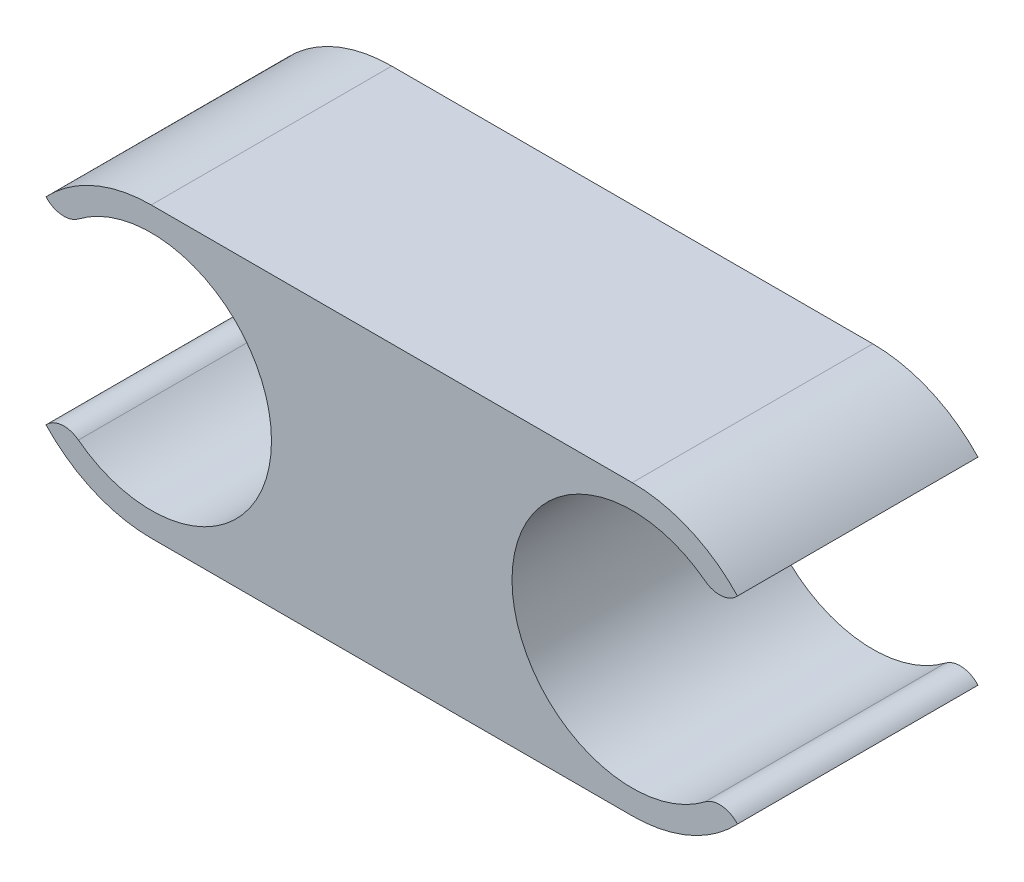
from build123d import *

# Parameters (mm, degrees)
EXTRUDE_1_DEPTH = 8
FILLET_1_R      = 0.8


with BuildPart() as part:
    # 草图1 → 凸台-拉伸1 (new body)
    with BuildSketch(Plane.XY):
        with BuildLine():
            Line((-25.471055476, -12.589310126), (-41.471055476, -12.589310126))
            ThreePointArc((-41.471055476, -12.589310126), (-38.076942926, -13.995197576), (-36.671055476, -17.389310126))
            ThreePointArc((-36.671055476, -17.389310126), (-38.076942926, -20.783422675), (-41.471055476, -22.189310126))
            Line((-41.471055476, -22.189310126), (-25.471055476, -22.189310126))
            ThreePointArc((-25.471055476, -22.189310126), (-30.271055476, -17.389310126), (-25.471055476, -12.589310126))
        make_face()
        with BuildLine():
            ThreePointArc((-36.671055476, -17.389310126), (-38.076942926, -13.995197576), (-41.471055476, -12.589310126))
            Line((-41.471055476, -12.589310126), (-41.471055476, -13.389310126))
            ThreePointArc((-41.471055476, -13.389310126), (-38.642628351, -14.560883001), (-37.471055476, -17.389310126))
            ThreePointArc((-37.471055476, -17.389310126), (-38.642628351, -20.21773725), (-41.471055476, -21.389310126))
            Line((-41.471055476, -21.389310126), (-41.471055476, -22.189310126))
            ThreePointArc((-41.471055476, -22.189310126), (-38.076942926, -20.783422675), (-36.671055476, -17.389310126))
        make_face()
        with BuildLine():
            Line((-25.471055476, -13.389310126), (-25.471055476, -12.589310126))
            ThreePointArc((-25.471055476, -12.589310126), (-30.271055476, -17.389310126), (-25.471055476, -22.189310126))
            Line((-25.471055476, -22.189310126), (-25.471055476, -21.389310126))
            ThreePointArc((-25.471055476, -21.389310126), (-29.471055476, -17.389310126), (-25.471055476, -13.389310126))
        make_face()
        with BuildLine():
            ThreePointArc((-21.971055476, -14.104496584), (-23.564108308, -12.984363758), (-25.471055476, -12.589310126))
            Line((-25.471055476, -12.589310126), (-25.471055476, -13.389310126))
            ThreePointArc((-25.471055476, -13.389310126), (-23.43954947, -13.943590557), (-21.971055476, -15.452818452))
            Line((-21.971055476, -15.452818452), (-21.971055476, -14.104496584))
        make_face()
        with BuildLine():
            Line((-25.471055476, -21.389310126), (-25.471055476, -22.189310126))
            ThreePointArc((-25.471055476, -22.189310126), (-23.564108308, -21.794256493), (-21.971055476, -20.674123667))
            Line((-21.971055476, -20.674123667), (-21.971055476, -19.325801799))
            ThreePointArc((-21.971055476, -19.325801799), (-23.43954947, -20.835029694), (-25.471055476, -21.389310126))
        make_face()
        with BuildLine():
            ThreePointArc((-21.971055476, -14.104496584), (-23.564108308, -12.984363758), (-25.471055476, -12.589310126))
            Line((-25.471055476, -12.589310126), (-25.471055476, -13.389310126))
            ThreePointArc((-25.471055476, -13.389310126), (-23.43954947, -13.943590557), (-21.971055476, -15.452818452))
            Line((-21.971055476, -15.452818452), (-21.971055476, -14.104496584))
        make_face()
        with BuildLine():
            Line((-25.471055476, -21.389310126), (-25.471055476, -22.189310126))
            ThreePointArc((-25.471055476, -22.189310126), (-23.564108308, -21.794256493), (-21.971055476, -20.674123667))
            Line((-21.971055476, -20.674123667), (-21.971055476, -19.325801799))
            ThreePointArc((-21.971055476, -19.325801799), (-23.43954947, -20.835029694), (-25.471055476, -21.389310126))
        make_face()
        with BuildLine():
            Line((-41.471055476, -13.389310126), (-41.471055476, -12.589310126))
            ThreePointArc((-41.471055476, -12.589310126), (-43.378002644, -12.984363758), (-44.971055476, -14.104496584))
            Line((-44.971055476, -14.104496584), (-44.971055476, -15.452818452))
            ThreePointArc((-44.971055476, -15.452818452), (-43.502561482, -13.943590557), (-41.471055476, -13.389310126))
        make_face()
        with BuildLine():
            Line((-41.471055476, -22.189310126), (-41.471055476, -21.389310126))
            ThreePointArc((-41.471055476, -21.389310126), (-43.502561482, -20.835029694), (-44.971055476, -19.325801799))
            Line((-44.971055476, -19.325801799), (-44.971055476, -20.674123667))
            ThreePointArc((-44.971055476, -20.674123667), (-43.378002644, -21.794256493), (-41.471055476, -22.189310126))
        make_face()
        with BuildLine():
            Line((-41.471055476, -13.389310126), (-41.471055476, -12.589310126))
            ThreePointArc((-41.471055476, -12.589310126), (-43.378002644, -12.984363758), (-44.971055476, -14.104496584))
            Line((-44.971055476, -14.104496584), (-44.971055476, -15.452818452))
            ThreePointArc((-44.971055476, -15.452818452), (-43.502561482, -13.943590557), (-41.471055476, -13.389310126))
        make_face()
        with BuildLine():
            Line((-41.471055476, -22.189310126), (-41.471055476, -21.389310126))
            ThreePointArc((-41.471055476, -21.389310126), (-43.502561482, -20.835029694), (-44.971055476, -19.325801799))
            Line((-44.971055476, -19.325801799), (-44.971055476, -20.674123667))
            ThreePointArc((-44.971055476, -20.674123667), (-43.378002644, -21.794256493), (-41.471055476, -22.189310126))
        make_face()
    extrude(amount=EXTRUDE_1_DEPTH)

    # 圆角1
    # the kernel refuses this fillet: 0.8 mm, written as the material it takes off along each edge
    with BuildSketch(Plane(origin=(-21.971055476, -15.452818452, -4.122167705), x_dir=(0, 1, 0), z_dir=(0, 0, 1)), Plane(origin=(-44.971055476, -19.325801799, -4.122167705), x_dir=(0, -1, 0), z_dir=(0, 0, 1))) as fillet_1_piece_1:
        with BuildLine():
            CenterArc((1.884003799, 0.594175789), FILLET_1_R, 142.743805491, 85.219808153)
            Line((1.247254554, 1.078479824), (1.234519569, 1.088165905))
            ThreePointArc((1.234519569, 1.088165905), (0.66933609, 0.486377982), (-0.007745967, 0.014))
            Line((-0.007745967, 0.014), (0, -0.016))
            ThreePointArc((0, -0.016), (0.674160934, -0.016), (1.337608229, -0.011883516))
            Line((1.337608229, -0.011883516), (1.348321868, 0))
        make_face()
    extrude(amount=16.24433541, mode=Mode.SUBTRACT)
    with BuildSketch(Plane(origin=(-21.971055476, -19.325801799, -4.122167705), x_dir=(-0.6540732337391989, -0.7564312294623664, 0), z_dir=(0, 0, 1))) as fillet_1_piece_2:
        with BuildLine():
            CenterArc((1.81375379, 0.782823335), FILLET_1_R, 172.885801288, 85.219808153)
            Line((1.019912768, 0.881901244), (1.004035948, 0.883882803))
            ThreePointArc((1.004035948, 0.883882803), (0.499491212, 0.453053522), (-0.010465172, 0.0121029))
            Line((-0.010465172, 0.0121029), (0.003297734, -0.015656467))
            ThreePointArc((0.003297734, -0.015656467), (0.824433541, 0.069883326), (1.645569348, -0.015656467))
            Line((1.645569348, -0.015656467), (1.648867082, 0))
        make_face()
    extrude(amount=16.24433541, mode=Mode.SUBTRACT)
    with BuildSketch(Plane(origin=(-44.971055476, -15.452818452, -4.122167705), x_dir=(0, 1, 0), z_dir=(0, 0, 1))) as fillet_1_piece_3:
        with BuildLine():
            CenterArc((1.884003799, -0.594175789), FILLET_1_R, 132.036386357, 85.219808153)
            Line((1.247254554, -1.078479824), (1.234519569, -1.088165905))
            ThreePointArc((1.234519569, -1.088165905), (0.66933609, -0.486377982), (-0.007745967, -0.014))
            Line((-0.007745967, -0.014), (0, 0.016))
            ThreePointArc((0, 0.016), (0.674160934, 0.016), (1.337608229, 0.011883516))
            Line((1.337608229, 0.011883516), (1.348321868, 0))
        make_face()
    extrude(amount=16.24433541, mode=Mode.SUBTRACT)


solid = part.part
